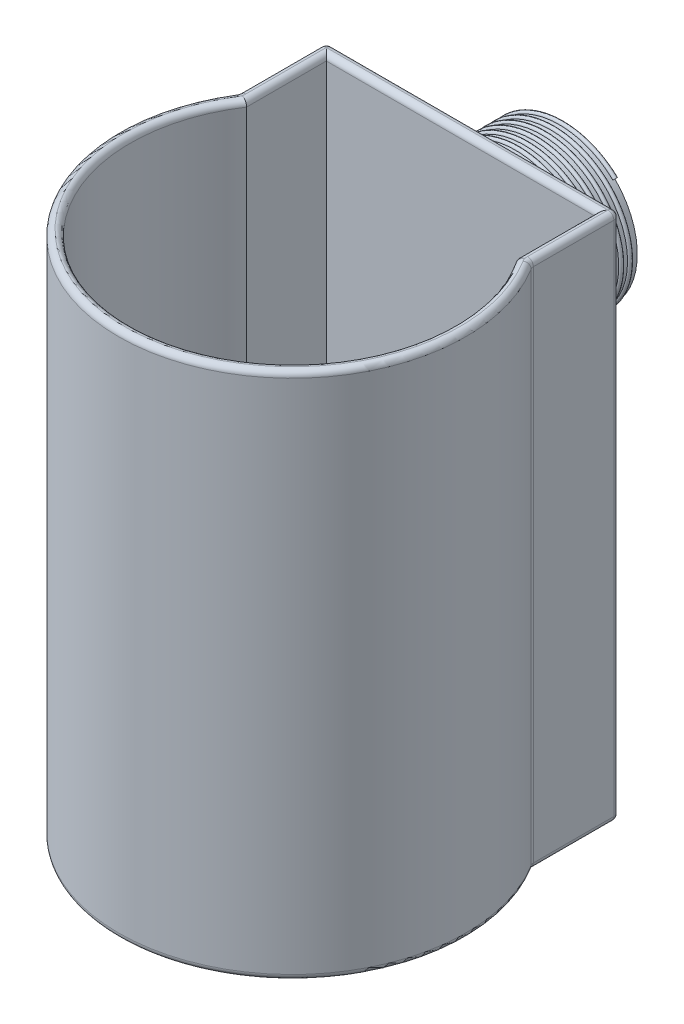
from build123d import *

# Parameters (mm, degrees)
SKETCH1_R                = 1.3
BOSS_EXTRUDE1_DEPTH      = 1.5
BOSS_EXTRUDE2_DEPTH      = 2
BOSS_EXTRUDE2_DEPTH_BACK = 7
CUT_EXTRUDE1_DEPTH       = 8.5
FILLET1_R                = 0.1
SWEEP1_PITCH             = 0.15


with BuildPart() as part:
    # Sketch1 → Boss-Extrude1 (new body)
    with BuildSketch(Plane.XY):
        Circle(SKETCH1_R)
    extrude(amount=-BOSS_EXTRUDE1_DEPTH)

    # Sketch2 → Boss-Extrude2 (add, two sides: drawn at the far end of the back side and taken through both)
    with BuildSketch(Plane(origin=(0, 0, 0), x_dir=(1, 0, 0), z_dir=(0, 1, 0)).offset(-BOSS_EXTRUDE2_DEPTH_BACK)):
        with BuildLine():
            Line((0, 0), (-2.5, 0))
            Line((-2.5, 0), (-2.5, -1.5))
            ThreePointArc((-2.5, -1.5), (0, -6.039941711), (2.5, -1.5))
            Line((2.5, -1.5), (2.5, 0))
            Line((2.5, 0), (0, 0))
        make_face()
    extrude(amount=BOSS_EXTRUDE2_DEPTH + BOSS_EXTRUDE2_DEPTH_BACK)

    # Sketch3 → Cut-Extrude1 (cut)
    with BuildSketch(Plane(origin=(0, 2, 0), x_dir=(1, 0, 0), z_dir=(0, 1, 0))):
        with BuildLine():
            Line((2.3, -0.2), (-2.3, -0.2))
            Line((-2.3, -0.2), (-2.3, -1.559055898))
            ThreePointArc((-2.3, -1.559055898), (0, -5.839941711), (2.3, -1.559055898))
            Line((2.3, -1.559055898), (2.3, -0.2))
        make_face()
    extrude(amount=-CUT_EXTRUDE1_DEPTH, mode=Mode.SUBTRACT)

    # Fillet1
    fillet1_edges = [part.edges().sort_by_distance(p)[0] for p in [
        (2.3, -2.25, 1.559055898),
        (2.3, 2, 0.879527949),
        (0, 2, 0.2),
        (-2.3, 2, 0.879527949),
        (0, 2, 5.839941711),
        (2.5, -2.5, 0),
        (2.5, -7, 0.75),
        (2.5, -2.5, 1.5),
        (0, -7, 6.039941711),
        (-2.5, -2.5, 1.5),
        (-2.5, -7, 0.75),
        (-2.5, -2.5, 0),
        (0, -7, 0),
        (0, 2, 0),
        (-2.5, 2, 0.75),
        (0, 2, 6.039941711),
        (2.5, 2, 0.75),
    ]]
    fillet(fillet1_edges, radius=FILLET1_R - 0.0001)  # a hair under: the kernel refuses the full size

    # Sweep1: the profile of Sweep1 profile screwed along a right-hand helix of 10 turns, 6 arcs to a turn; built about Z, then put on its axis
    sweep1_z = Axis((0, 0, 0), (0, 0, 1))
    sweep1_corners = [(1.335, 0, 0), (1.3, 0.000642633, -0.0349941), (1.265, 0, 0), (1.3, -0.000642633, 0.0349941)]
    with BuildLine(mode=Mode.PRIVATE) as sweep1_profile:
        ThreePointArc((1.335, 0, 0), (1.324748737, 0.00045441, -0.024744565), (1.3, 0.000642633, -0.0349941))
        ThreePointArc((1.3, 0.000642633, -0.0349941), (1.275251263, 0.00045441, -0.024744565), (1.265, 0, 0))
        ThreePointArc((1.265, 0, 0), (1.275251263, -0.00045441, 0.024744565), (1.3, -0.000642633, 0.0349941))
        ThreePointArc((1.3, -0.000642633, 0.0349941), (1.324748737, -0.00045441, 0.024744565), (1.335, 0, 0))
    sweep1_cap = Face(sweep1_profile.wire())
    sweep1_arcs = [((1.335, 0, 0), (1.335, 0.000642633, -0.0349941), (1.3, 0.000642633, -0.0349941), (1, 0.7071067811865476, 1)), ((1.3, 0.000642633, -0.0349941), (1.265, 0.000642633, -0.0349941), (1.265, 0, 0), (1, 0.7071067811865476, 1)), ((1.265, 0, 0), (1.265, -0.000642633, 0.0349941), (1.3, -0.000642633, 0.0349941), (1, 0.7071067811865476, 1)), ((1.3, -0.000642633, 0.0349941), (1.335, -0.000642633, 0.0349941), (1.335, 0, 0), (1, 0.7071067811865476, 1))]  # start, shoulder, end, weights
    sweep1_turn_angles = [0, 30, 60, 90, 120, 150, 180, 210, 240, 270, 300, 330, 360]
    sweep1_turn_weights = [1, 0.8660254037844387, 1, 0.8660254037844387, 1, 0.8660254037844387, 1, 0.8660254037844387, 1, 0.8660254037844387, 1, 0.8660254037844387, 1]
    sweep1_turn_sides = [Face.make_bezier_surface([[Vector(p[j][0], p[j][1], 0).rotate(sweep1_z, sweep1_turn_angles[2 * i + k]) / sweep1_turn_weights[2 * i + k] + Vector(0, 0, p[j][2] + SWEEP1_PITCH * sweep1_turn_angles[2 * i + k] / 360) for k in range(3)] for j in range(3)], [[p[3][j] * sweep1_turn_weights[2 * i + k] for k in range(3)] for j in range(3)]) for p in sweep1_arcs for i in range(6)]
    sweep1 = Plane(origin=(0, 0, -1.5), x_dir=(0.7071067811865513, 0.7071067811865438, 0), z_dir=(0, 0, 1)) * Solid(Shell([*[p.moved(Location((0, 0, SWEEP1_PITCH * i))) for i in range(10) for p in sweep1_turn_sides], sweep1_cap, sweep1_cap.rotate(sweep1_z, 3600).moved(Location((0, 0, SWEEP1_PITCH * 3600 / 360)))]))
    add(sweep1)


solid = part.part
